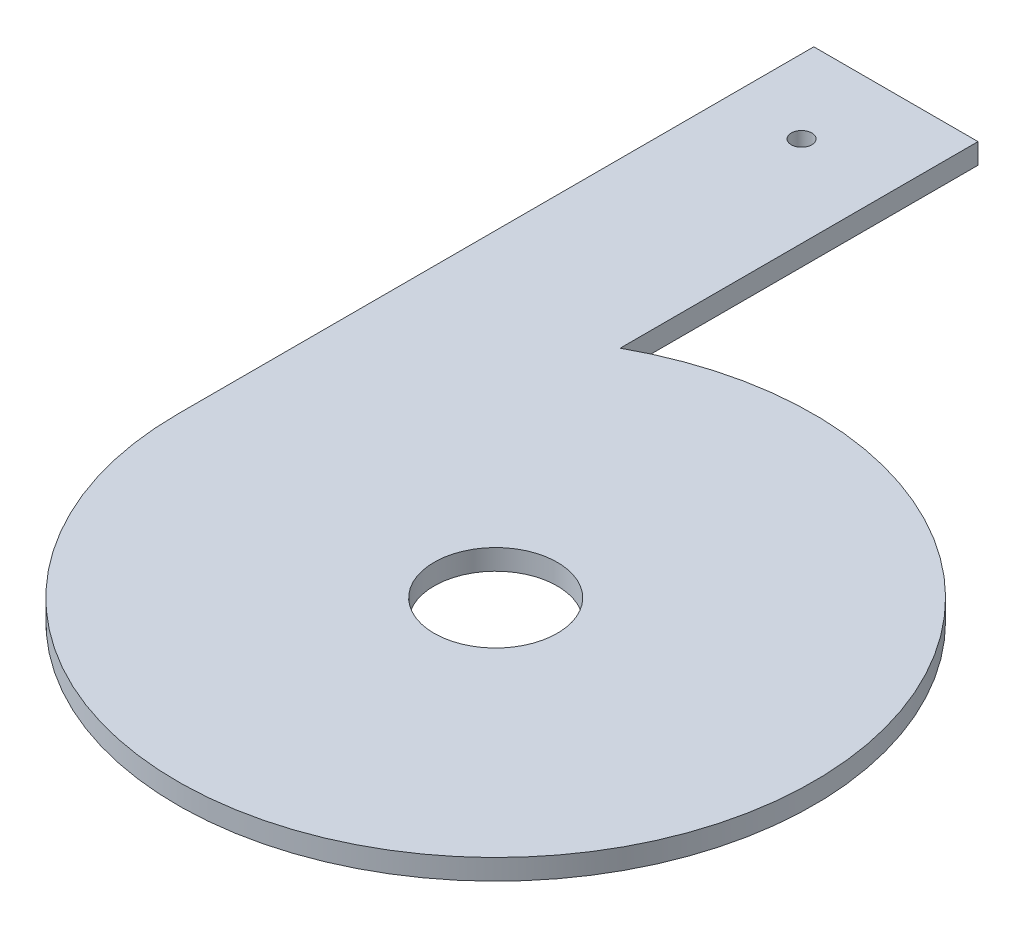
from build123d import *

# Parameters (mm, degrees)
SKETCH1_R           = 31
BOSS_EXTRUDE1_DEPTH = 2
SKETCH2_R           = 6
CUT_EXTRUDE1_DEPTH  = 2
SKETCH3_W           = 16
SKETCH3_H           = 62
BOSS_EXTRUDE2_DEPTH = 2
CUT_EXTRUDE2_REACH  = 71.347
SKETCH8_R           = 1


with BuildPart() as part:
    # Sketch1 → Boss-Extrude1 (new body)
    with BuildSketch(Plane(origin=(0, 0, 0), x_dir=(1, 0, 0), z_dir=(0, 1, 0))):
        Circle(SKETCH1_R)
    extrude(amount=BOSS_EXTRUDE1_DEPTH)

    # Sketch2 → Cut-Extrude1 (cut)
    with BuildSketch(Plane(origin=(0, 2, 0), x_dir=(1, 0, 0), z_dir=(0, 1, 0))):
        Circle(SKETCH2_R)
    extrude(amount=-CUT_EXTRUDE1_DEPTH, mode=Mode.SUBTRACT)

    # Sketch3 → Boss-Extrude2 (add)
    with BuildSketch(Plane(origin=(0, 2, 0), x_dir=(1, 0, 0), z_dir=(0, 1, 0))):
        with Locations((-23, 31)):
            Rectangle(SKETCH3_W, SKETCH3_H)
    extrude(amount=-BOSS_EXTRUDE2_DEPTH)

    # Sketch8 → Cut-Extrude2 (cut, up to next)
    with BuildSketch(Plane.XZ, mode=Mode.PRIVATE) as cut_extrude2_sk1:
        with Locations((-23.826787018, -53.631408604)):
            Circle(SKETCH8_R)
    cut_extrude2_tool1 = extrude(cut_extrude2_sk1.sketch, amount=-CUT_EXTRUDE2_REACH, mode=Mode.PRIVATE) & part.part
    add(cut_extrude2_tool1.solids().sort_by_distance((-23.826787, 0, -53.631409))[0], mode=Mode.SUBTRACT)


solid = part.part
